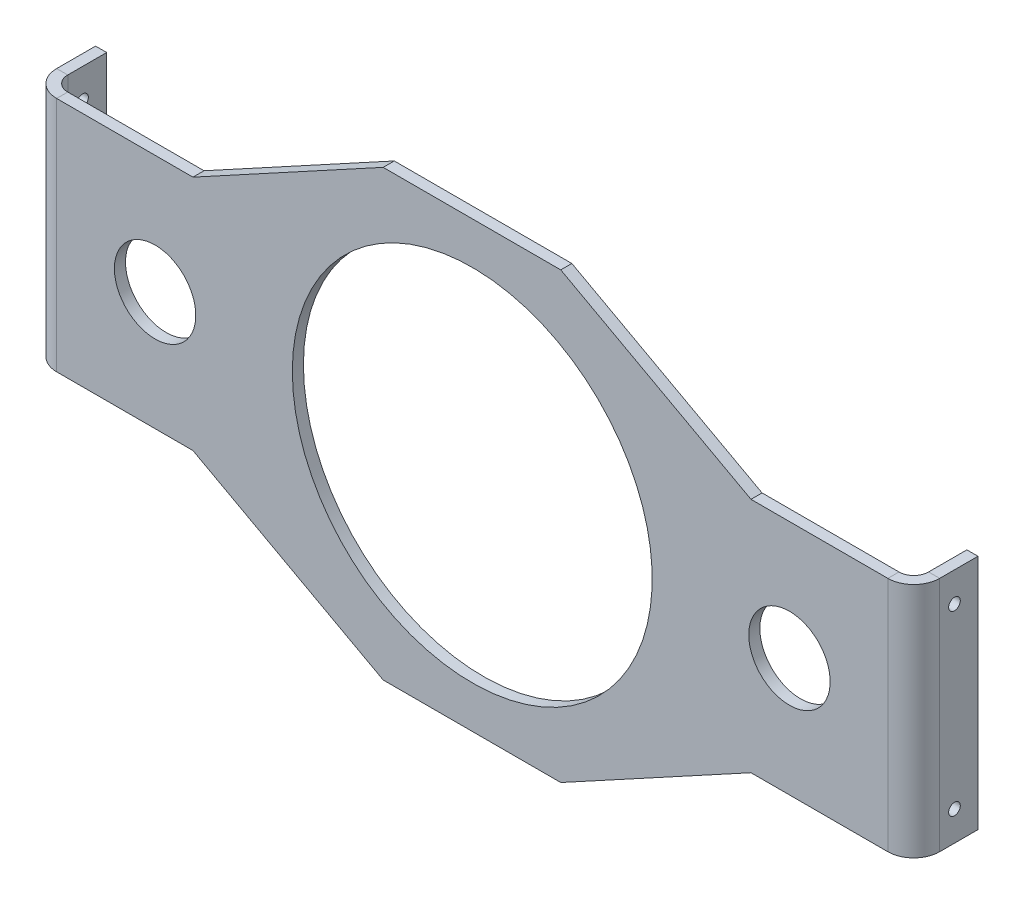
from build123d import *

# Parameters (mm, degrees)
BOSS_EXTRUDE1_DEPTH             = 2.38125
SKETCH2_R                       = 38.608
SKETCH2_R_2                     = 8.73125
CUT_EXTRUDE1_DEPTH              = 2.38125
SKETCHED_START                  = 31.75
SKETCHED_BEND1_DEPTH            = 50.8
SKETCHED_BEND1_2_DEPTH          = 50.8
SKETCHED_BEND2_DEPTH            = 50.8
SKETCHED_BEND2_2_DEPTH          = 50.8
TAP_DRILL_FOR_M3X0_5_TAP1_D     = 2.5
TAP_DRILL_FOR_M3X0_5_TAP1_DEPTH = 2.38125
TAP_DRILL_FOR_M3X0_5_TAP2_D     = 2.5


# Read off the part's stored shape, not the designer's step: Sketched Bend1, Sketched Bend2
with BuildPart() as part:
    # Sketch1 → Boss-Extrude1 (new body)
    with BuildSketch(Plane.XY):
        Polygon((-55.274119317, 31.75), (-10.824119317, 31.75), (29.9865, 9.525), (68.0865, 9.525), (108.897119317, 31.75), (153.347119317, 31.75), (153.347119317, 82.55), (108.897119317, 82.55), (68.0865, 104.775), (29.9865, 104.775), (-10.824119317, 82.55), (-55.274119317, 82.55), align=None)
    extrude(amount=BOSS_EXTRUDE1_DEPTH)

    # Sketch2 → Cut-Extrude1 (cut)
    with BuildSketch(Plane(origin=(0, 0, 0), x_dir=(-1, 0, 0), z_dir=(0, 0, -1))):
        with Locations((-49.1, 57.15)):
            Circle(SKETCH2_R)
        with Locations((-117.15, 57.15)):
            Circle(SKETCH2_R_2)
        with Locations((18.95, 57.15)):
            Circle(SKETCH2_R_2)
    extrude(amount=-CUT_EXTRUDE1_DEPTH, mode=Mode.SUBTRACT)

    # Sketched Bend1 outline → Sketched Bend1 (cut)
    with BuildSketch(Plane(origin=(0, 0, 0), x_dir=(1, 0, 0), z_dir=(0, 1, 0)).offset(SKETCHED_START)):
        with BuildLine():
            Line((153.347119317, 0), (142.825615918, 0))
            ThreePointArc((142.825615918, 0), (140.837913282, -1.750089228), (138.265869317, -2.38125))
            Line((138.265869317, -2.38125), (153.347119317, -2.38125))
            Line((153.347119317, -2.38125), (153.347119317, 0))
        make_face()
    extrude(amount=SKETCHED_BEND1_DEPTH, mode=Mode.SUBTRACT)

    # Sketched Bend1 2 outline → Sketched Bend1 2 (add)
    with BuildSketch(Plane(origin=(0, 0, 0), x_dir=(1, 0, 0), z_dir=(0, 1, 0)).offset(SKETCHED_START)):
        with BuildLine():
            Line((143.822119317, 3.175), (143.822119317, 11.398742286))
            Line((143.822119317, 11.398742286), (141.440869317, 11.398742286))
            Line((141.440869317, 11.398742286), (141.440869317, 3.175))
            ThreePointArc((141.440869317, 3.175), (140.510933348, 0.929935969), (138.265869317, 0))
            Line((138.265869317, 0), (142.825615918, 0))
            ThreePointArc((142.825615918, 0), (143.567143037, 1.511145738), (143.822119317, 3.175))
        make_face()
    extrude(amount=SKETCHED_BEND1_2_DEPTH)

    # Sketched Bend2 outline → Sketched Bend2 (cut)
    with BuildSketch(Plane(origin=(0, 0, 0), x_dir=(1, 0, 0), z_dir=(0, 1, 0)).offset(SKETCHED_START)):
        with BuildLine():
            ThreePointArc((-40.065869317, -2.38125), (-42.637913282, -1.750089228), (-44.625615918, 0))
            Line((-44.625615918, 0), (-55.274119317, 0))
            Line((-55.274119317, 0), (-55.274119317, -2.38125))
            Line((-55.274119317, -2.38125), (-40.065869317, -2.38125))
        make_face()
    extrude(amount=SKETCHED_BEND2_DEPTH, mode=Mode.SUBTRACT)

    # Sketched Bend2 2 outline → Sketched Bend2 2 (add)
    with BuildSketch(Plane(origin=(0, 0, 0), x_dir=(1, 0, 0), z_dir=(0, 1, 0)).offset(SKETCHED_START)):
        with BuildLine():
            ThreePointArc((-40.065869317, 0), (-42.310933347, 0.92993597), (-43.240869317, 3.175))
            Line((-43.240869317, 3.175), (-43.240869317, 11.525742286))
            Line((-43.240869317, 11.525742286), (-45.622119317, 11.525742286))
            Line((-45.622119317, 11.525742286), (-45.622119317, 3.175))
            ThreePointArc((-45.622119317, 3.175), (-45.367143037, 1.511145738), (-44.625615918, 0))
            Line((-44.625615918, 0), (-40.065869317, 0))
        make_face()
    extrude(amount=SKETCHED_BEND2_2_DEPTH)

    # Tap Drill for M3x0.5 Tap1
    with Locations(Plane(origin=(143.822119317, 0, 0), x_dir=(0, 0, -1), z_dir=(1, 0, 0))):
        with Locations((6.35, 76.2), (6.35, 38.1)):
            Hole(TAP_DRILL_FOR_M3X0_5_TAP1_D / 2, depth=TAP_DRILL_FOR_M3X0_5_TAP1_DEPTH)

    # Tap Drill for M3x0.5 Tap2 (through all)
    with Locations(Plane.ZY.offset(45.622119317)):
        with Locations((-6.35, 76.2), (-6.35, 38.1)):
            Hole(TAP_DRILL_FOR_M3X0_5_TAP2_D / 2)


solid = part.part
